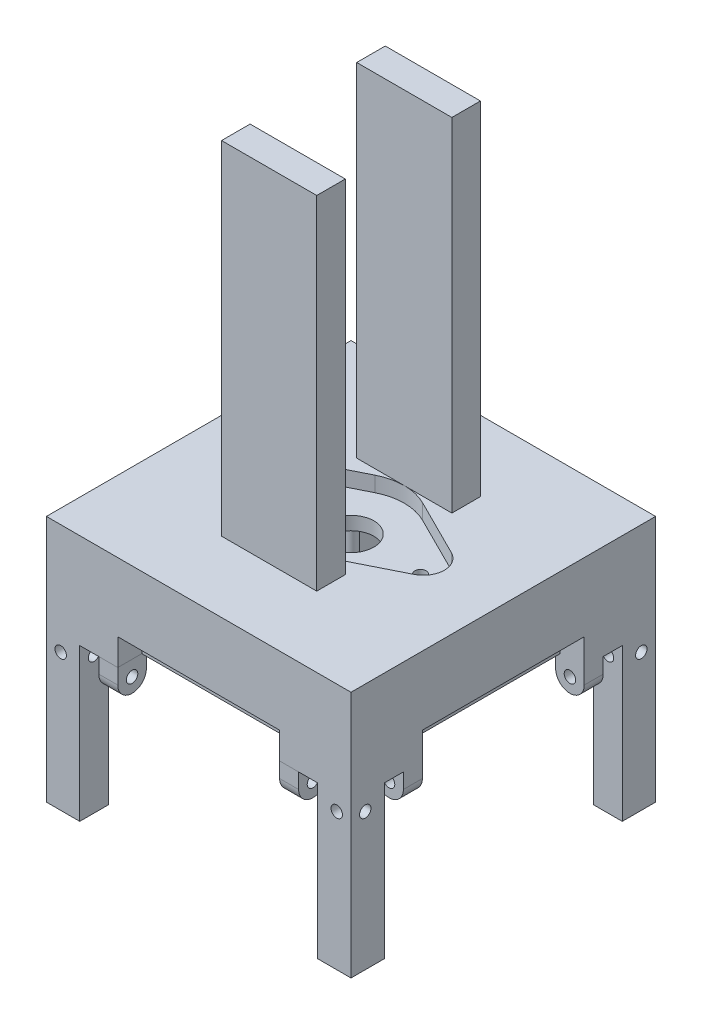
from build123d import *

# Parameters (mm, degrees)
MAIN_EXTRUDE_DEPTH                            = 65
SHELL2_T                                      = -7.5
SHELL_CORNER_FILLET_R                         = 5
SKETCH14_R                                    = 6
TOP_HOLE_DEPTH                                = 7.5
SKETCH24_W                                    = 62.5
SKETCH24_H                                    = 7.5
MAIN_DOOR_DEPTH                               = 40
SKETCH40_R                                    = 1.6
BOLT_GUIDE_DEPTH                              = 50
SKETCH35_R                                    = 1.5
DOOR_ROUNDING_DEPTH                           = 62.5
SKETCH35_3_R                                  = 1.5
DOOR_SCREW_DEPTH                              = 105.410547839
SKETCH39_W                                    = 21.25
SKETCH39_H                                    = 7.5
SKETCH39_W_2                                  = 5
DOOR_TEETH_DEPTH                              = 7.75
SKETCH41_R                                    = 1.5
LEAD_HOLDER_PLACE_DEPTH                       = 4
SKETCH41_2_R                                  = 1.5
LEAD_HOLDER_HOLES_DEPTH                       = 7.5
SKETCH43_W                                    = 25
SKETCH43_H                                    = 7.5
MOTOR_TOWERS_DEPTH                            = 90
SKETCH45_W                                    = 48.5
SKETCH45_H                                    = 8
SPRING_BACK_SUPPORT_DEPTH                     = 3
SPRING_BACK_SUPPORT_SUPPORT_SIZE              = 3
SKETCH47_W                                    = 42.5
SKETCH47_H                                    = 11
SPRING_PLACE_DEPTH                            = 6.3
DOOR_PTR_COUNT                                = 4
DOOR_ROUNDING_PTR_START                       = -26.25
DOOR_ROUNDING_PTR_OUTLINE_R                   = 1.5
DOOR_ROUNDING_PTR_DEPTH                       = 5
DOOR_ROUNDING_PTR_START_2                     = 21.25
DOOR_ROUNDING_PTR_2_OUTLINE_R                 = 1.5
DOOR_ROUNDING_PTR_2_DEPTH                     = 5
DOOR_ROUNDING_PTR_3_OUTLINE_R                 = 1.5
DOOR_ROUNDING_PTR_3_DEPTH                     = 5
DOOR_ROUNDING_PTR_4_OUTLINE_R                 = 1.5
DOOR_ROUNDING_PTR_4_DEPTH                     = 5
DOOR_SCREW_PTR_COUNT                          = 4
SPRING_PLACING_PTR_COUNT                      = 4
SPRING_BACK_SUPPORT_SUPPORT_OF_SPRING_PL_SIZE = 3


# Read off the part's stored shape, not the designer's step: door-rounding-ptr
with BuildPart() as part:
    # Sketch11 → main-extrude (new body)
    with BuildSketch(Plane(origin=(0, 0, 0), x_dir=(1, 0, 0), z_dir=(0, 1, 0))):
        Polygon((40, -40), (40, 0), (40, 40), (0, 40), (-40, 40), (-40, 0), (-40, -40), (0, -40), align=None)
    extrude(amount=MAIN_EXTRUDE_DEPTH)

    # Shell2
    shell2_openings = [part.faces().sort_by_distance(p)[0] for p in [
        (0, 0, 0),
    ]]
    offset(amount=SHELL2_T, openings=shell2_openings, kind=Kind.INTERSECTION)

    # shell-corner-fillet
    shell_corner_fillet_edges = [part.edges().sort_by_distance(p)[0] for p in [
        (0, 57.5, -32.5),
        (-32.5, 57.5, 0),
        (0, 57.5, 32.5),
        (32.5, 57.5, 0),
    ]]
    fillet(shell_corner_fillet_edges, radius=SHELL_CORNER_FILLET_R)

    # Sketch14 → top-hole (cut)
    with BuildSketch(Plane(origin=(0, 65, 0), x_dir=(1, 0, 0), z_dir=(0, 1, 0))):
        with Locations(Location((0, 0, 0), (0, 0, 270))):
            Circle(SKETCH14_R)
    extrude(amount=-TOP_HOLE_DEPTH, mode=Mode.SUBTRACT)

    # Sketch24 → main-door (cut)
    with BuildSketch(Plane.XZ):
        with Locations((0, 36.25)):
            Rectangle(SKETCH24_W, SKETCH24_H)
    main_door = extrude(amount=-MAIN_DOOR_DEPTH, mode=Mode.SUBTRACT)

    # Sketch40 → bolt-guide (add)
    with BuildSketch(Plane.XZ.offset(-57.5)):
        with Locations(Location((-5.656854249, -5.656854249, 0), (0, 0, 90))):
            Circle(SKETCH40_R)
        with Locations(Location((5.656854249, 5.656854249, 0), (0, 0, 90))):
            Circle(SKETCH40_R)
    extrude(amount=BOLT_GUIDE_DEPTH)

    # Sketch35<3> → door-screw (cut, symmetric)
    with BuildSketch(Plane.ZY.offset(-31.25)):
        with Locations((36.25, 36)):
            Circle(SKETCH35_3_R)
    door_screw = extrude(amount=DOOR_SCREW_DEPTH, both=True, mode=Mode.SUBTRACT)

    # Sketch41 → lead-holder-place (cut)
    with BuildSketch(Plane(origin=(0, 65, 0), x_dir=(1, 0, 0), z_dir=(0, 1, 0))):
        with BuildLine():
            Line((-21.460526316, 4.918923688), (-6.263157895, 12.520896661))
            ThreePointArc((-6.263157895, 12.520896661), (0, 14), (6.263157895, 12.520896661))
            Line((6.263157895, 12.520896661), (21.460526316, 4.918923688))
            ThreePointArc((21.460526316, 4.918923688), (24.5, 0), (21.460526316, -4.918923688))
            Line((21.460526316, -4.918923688), (6.263157895, -12.520896661))
            ThreePointArc((6.263157895, -12.520896661), (0, -14), (-6.263157895, -12.520896661))
            Line((-6.263157895, -12.520896661), (-21.460526316, -4.918923688))
            ThreePointArc((-21.460526316, -4.918923688), (-24.5, 0), (-21.460526316, 4.918923688))
        make_face()
        with Locations(Location((-18.25, 0, 0), (0, 0, 270))):
            Circle(SKETCH41_R, mode=Mode.SUBTRACT)
        with Locations(Location((18.25, 0, 0), (0, 0, 90))):
            Circle(SKETCH41_R, mode=Mode.SUBTRACT)
    extrude(amount=-LEAD_HOLDER_PLACE_DEPTH, mode=Mode.SUBTRACT)

    # Sketch41<2> → lead-holder-holes (cut)
    with BuildSketch(Plane(origin=(0, 65, 0), x_dir=(1, 0, 0), z_dir=(0, 1, 0))):
        with Locations(Location((-18.25, 0, 0), (0, 0, 270))):
            Circle(SKETCH41_2_R)
        with Locations(Location((18.25, 0, 0), (0, 0, 270))):
            Circle(SKETCH41_2_R)
    extrude(amount=-LEAD_HOLDER_HOLES_DEPTH, mode=Mode.SUBTRACT)

    # Sketch43 → motor-towers (add)
    with BuildSketch(Plane(origin=(0, 65, 0), x_dir=(1, 0, 0), z_dir=(0, 1, 0))):
        with Locations((0, 17.75)):
            Rectangle(SKETCH43_W, SKETCH43_H)
        with Locations((0, -17.75)):
            Rectangle(SKETCH43_W, SKETCH43_H)
    extrude(amount=MOTOR_TOWERS_DEPTH)

    # Sketch47 → spring-place (cut)
    with BuildSketch(Plane.XY.offset(40)):
        with Locations((0, 41.5)):
            Rectangle(SKETCH47_W, SKETCH47_H)
    spring_place = extrude(amount=-SPRING_PLACE_DEPTH, mode=Mode.SUBTRACT)

    # door-ptr: main-door ×4 about axis
    door_ptr_axis = Axis((0, 0, 0), (0, 1, 0))
    for i in range(1, DOOR_PTR_COUNT):
        add(main_door.rotate(door_ptr_axis, i * 360 / DOOR_PTR_COUNT), mode=Mode.SUBTRACT)

    # door-rounding-ptr outline → door-rounding-ptr (add)
    with BuildSketch(Plane.YZ.offset(DOOR_ROUNDING_PTR_START)):
        with BuildLine():
            ThreePointArc((36, -32.5), (32.25, -36.25), (36, -40))
            Line((36, -40), (40, -40))
            Line((40, -40), (40, -32.5))
            Line((40, -32.5), (36, -32.5))
        make_face()
        with Locations((36, -36.25)):
            Circle(DOOR_ROUNDING_PTR_OUTLINE_R, mode=Mode.SUBTRACT)
    extrude(amount=DOOR_ROUNDING_PTR_DEPTH)

    # door-rounding-ptr 2 outline → door-rounding-ptr 2 (add)
    with BuildSketch(Plane.YZ.offset(DOOR_ROUNDING_PTR_START_2)):
        with BuildLine():
            ThreePointArc((36, -32.5), (32.25, -36.25), (36, -40))
            Line((36, -40), (40, -40))
            Line((40, -40), (40, -32.5))
            Line((40, -32.5), (36, -32.5))
        make_face()
        with Locations((36, -36.25)):
            Circle(DOOR_ROUNDING_PTR_2_OUTLINE_R, mode=Mode.SUBTRACT)
    extrude(amount=DOOR_ROUNDING_PTR_2_DEPTH)

    # door-rounding-ptr 3 outline → door-rounding-ptr 3 (add)
    # profile 1 of 2: a face of its own
    with BuildSketch(Plane.XY.offset(DOOR_ROUNDING_PTR_START)):
        with BuildLine():
            Line((-40, 40), (-40, 36))
            ThreePointArc((-40, 36), (-36.25, 32.25), (-32.5, 36))
            Line((-32.5, 36), (-32.5, 40))
            Line((-32.5, 40), (-40, 40))
        make_face()
        with Locations((-36.25, 36)):
            Circle(DOOR_ROUNDING_PTR_3_OUTLINE_R, mode=Mode.SUBTRACT)
    # profile 2 of 2: a face of its own
    with BuildSketch(Plane.XY.offset(DOOR_ROUNDING_PTR_START)):
        with BuildLine():
            ThreePointArc((32.5, 36), (36.25, 32.25), (40, 36))
            Line((40, 36), (40, 40))
            Line((40, 40), (32.5, 40))
            Line((32.5, 40), (32.5, 36))
        make_face()
        with Locations((36.25, 36)):
            Circle(DOOR_ROUNDING_PTR_3_OUTLINE_R, mode=Mode.SUBTRACT)
    extrude(amount=DOOR_ROUNDING_PTR_3_DEPTH)

    # door-rounding-ptr 4 outline → door-rounding-ptr 4 (add)
    # profile 1 of 2: a face of its own
    with BuildSketch(Plane.XY.offset(DOOR_ROUNDING_PTR_START_2)):
        with BuildLine():
            Line((-40, 40), (-40, 36))
            ThreePointArc((-40, 36), (-36.25, 32.25), (-32.5, 36))
            Line((-32.5, 36), (-32.5, 40))
            Line((-32.5, 40), (-40, 40))
        make_face()
        with Locations((-36.25, 36)):
            Circle(DOOR_ROUNDING_PTR_4_OUTLINE_R, mode=Mode.SUBTRACT)
    # profile 2 of 2: a face of its own
    with BuildSketch(Plane.XY.offset(DOOR_ROUNDING_PTR_START_2)):
        with BuildLine():
            ThreePointArc((32.5, 36), (36.25, 32.25), (40, 36))
            Line((40, 36), (40, 40))
            Line((40, 40), (32.5, 40))
            Line((32.5, 40), (32.5, 36))
        make_face()
        with Locations((36.25, 36)):
            Circle(DOOR_ROUNDING_PTR_4_OUTLINE_R, mode=Mode.SUBTRACT)
    extrude(amount=DOOR_ROUNDING_PTR_4_DEPTH)

    # door-screw-ptr: door-screw ×4 about axis
    door_screw_ptr_axis = Axis((0, 0, 0), (0, 1, 0))
    for i in range(1, DOOR_SCREW_PTR_COUNT):
        add(door_screw.rotate(door_screw_ptr_axis, i * 360 / DOOR_SCREW_PTR_COUNT), mode=Mode.SUBTRACT)


with BuildPart() as body_2:
    # Sketch35 → door-rounding (new body)
    with BuildSketch(Plane.ZY.offset(-31.25)):
        with BuildLine():
            Line((32.5, 40), (32.5, 36))
            ThreePointArc((32.5, 36), (36.25, 32.25), (40, 36))
            Line((40, 36), (40, 40))
            Line((40, 40), (32.5, 40))
        make_face()
        with Locations((36.25, 36)):
            Circle(SKETCH35_R, mode=Mode.SUBTRACT)
    extrude(amount=DOOR_ROUNDING_DEPTH)

    # Sketch39 → door-teeth (cut)
    with BuildSketch(Plane.XZ.offset(-32.25)):
        with Locations((10.625, 36.25)):
            Rectangle(SKETCH39_W, SKETCH39_H)
        with Locations((-10.625, 36.25)):
            Rectangle(SKETCH39_W, SKETCH39_H)
        with Locations((28.75, 36.25)):
            Rectangle(SKETCH39_W_2, SKETCH39_H)
        with Locations((-28.75, 36.25)):
            Rectangle(SKETCH39_W_2, SKETCH39_H)
    extrude(amount=-DOOR_TEETH_DEPTH, mode=Mode.SUBTRACT)


with BuildPart() as door_teeth_piece_1:
    # of the separate pieces the step leaves, piece 1, a body of its own (door_teeth_pieces)
    add(body_2.part.solids().sort_by_distance((-21.25, 36, 40))[0])


with BuildPart() as door_teeth_piece_2:
    # of the separate pieces the step leaves, piece 2, a body of its own (door_teeth_pieces)
    add(body_2.part.solids().sort_by_distance((26.25, 36, 40))[0])


with BuildPart() as body_4:
    # Sketch45 → spring-back-support (new body)
    with BuildSketch(Plane(origin=(-65, 0, 32.5), x_dir=(-1, 0, 0), z_dir=(0, 0, -1))):
        with Locations((-65, 44)):
            Rectangle(SKETCH45_W, SKETCH45_H)
    spring_back_support = extrude(amount=SPRING_BACK_SUPPORT_DEPTH)

    # spring-back-support-support
    spring_back_support_support_edges = [body_4.edges().sort_by_distance(p)[0] for p in [
        (-24.25, 44, 29.5),
        (24.25, 44, 29.5),
        (0, 48, 29.5),
    ]]
    chamfer(spring_back_support_support_edges, length=SPRING_BACK_SUPPORT_SUPPORT_SIZE - 0.0001)  # a hair under: the kernel refuses the full size


with BuildPart() as part_1:
    add(part.part)

    # spring-placing-ptr: spring-back-support, spring-place ×4 about axis
    spring_placing_ptr_axis = Axis((0, 0, 0), (0, 1, 0))
    add([spring_back_support.rotate(spring_placing_ptr_axis, i * 360 / SPRING_PLACING_PTR_COUNT) for i in range(1, SPRING_PLACING_PTR_COUNT)])
    add([spring_place.rotate(spring_placing_ptr_axis, i * 360 / SPRING_PLACING_PTR_COUNT) for i in range(1, SPRING_PLACING_PTR_COUNT)], mode=Mode.SUBTRACT)

    # spring-back-support-support of spring-pl
    spring_back_support_support_of_spring_pl_edges = [part_1.edges().sort_by_distance(p)[0] for p in [
        (29.5, 44, 24.25),
        (29.5, 44, -24.25),
        (29.5, 48, 0),
        (24.25, 44, -29.5),
        (-24.25, 44, -29.5),
        (0, 48, -29.5),
        (-29.5, 44, -24.25),
        (-29.5, 44, 24.25),
        (-29.5, 48, 0),
    ]]
    chamfer(spring_back_support_support_of_spring_pl_edges, length=SPRING_BACK_SUPPORT_SUPPORT_OF_SPRING_PL_SIZE - 0.0001)  # a hair under: the kernel refuses the full size


solid = Compound([door_teeth_piece_1.part, door_teeth_piece_2.part, body_4.part, part_1.part])
